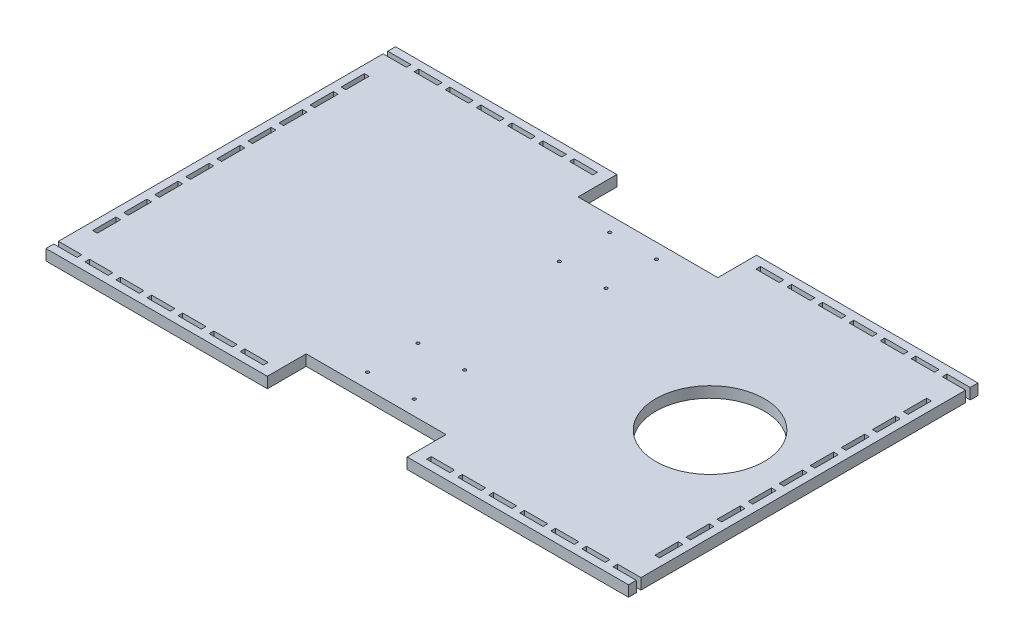
from build123d import *

# Parameters (mm, degrees)
SKETCH6_W           = 15
SKETCH6_H           = 3
SKETCH6_W_2         = 3
SKETCH6_H_2         = 15
SKETCH6_R           = 1
SKETCH6_R_2         = 35
BOSS_EXTRUDE3_DEPTH = 7


with BuildPart() as part:
    # Sketch6 → Boss-Extrude3 (new body)
    with BuildSketch(Plane(origin=(0, 0, 0), x_dir=(1, 0, 0), z_dir=(0, 1, 0))):
        Polygon((-45, 112.5), (-187.5, 112.5), (-187.5, 107.5), (-172.5, 107.5), (-172.5, 104.5), (-187.5, 104.5), (-187.5, -104.5), (-172.5, -104.5), (-172.5, -107.5), (-187.5, -107.5), (-187.5, -112.5), (-45, -112.5), (-45, -87.5), (45, -87.5), (45, -112.5), (187.5, -112.5), (187.5, -107.5), (172.5, -107.5), (172.5, -104.5), (187.5, -104.5), (187.5, 104.5), (172.5, 104.5), (172.5, 107.5), (187.5, 107.5), (187.5, 112.5), (45, 112.5), (45, 87.5), (-45, 87.5), align=None)
        with Locations((-160, -106)):
            Rectangle(SKETCH6_W, SKETCH6_H, mode=Mode.SUBTRACT)
        with Locations((-140, -106)):
            Rectangle(SKETCH6_W, SKETCH6_H, mode=Mode.SUBTRACT)
        with Locations((-120, -106)):
            Rectangle(SKETCH6_W, SKETCH6_H, mode=Mode.SUBTRACT)
        with Locations((-100, -106)):
            Rectangle(SKETCH6_W, SKETCH6_H, mode=Mode.SUBTRACT)
        with Locations((-181, -80)):
            Rectangle(SKETCH6_W_2, SKETCH6_H_2, mode=Mode.SUBTRACT)
        with Locations((-181, -60)):
            Rectangle(SKETCH6_W_2, SKETCH6_H_2, mode=Mode.SUBTRACT)
        with Locations((-80, -106)):
            Rectangle(SKETCH6_W, SKETCH6_H, mode=Mode.SUBTRACT)
        with Locations((-60, -106)):
            Rectangle(SKETCH6_W, SKETCH6_H, mode=Mode.SUBTRACT)
        with Locations((-15, -77.920021532)):
            Circle(SKETCH6_R, mode=Mode.SUBTRACT)
        with Locations((-181, -40)):
            Rectangle(SKETCH6_W_2, SKETCH6_H_2, mode=Mode.SUBTRACT)
        with Locations((-181, -20)):
            Rectangle(SKETCH6_W_2, SKETCH6_H_2, mode=Mode.SUBTRACT)
        with Locations((-15, -45.520021532)):
            Circle(SKETCH6_R, mode=Mode.SUBTRACT)
        with Locations((60, -106)):
            Rectangle(SKETCH6_W, SKETCH6_H, mode=Mode.SUBTRACT)
        with Locations((80, -106)):
            Rectangle(SKETCH6_W, SKETCH6_H, mode=Mode.SUBTRACT)
        with Locations((15, -77.920021532)):
            Circle(SKETCH6_R, mode=Mode.SUBTRACT)
        with Locations((100, -106)):
            Rectangle(SKETCH6_W, SKETCH6_H, mode=Mode.SUBTRACT)
        with Locations((120, -106)):
            Rectangle(SKETCH6_W, SKETCH6_H, mode=Mode.SUBTRACT)
        with Locations((140, -106)):
            Rectangle(SKETCH6_W, SKETCH6_H, mode=Mode.SUBTRACT)
        with Locations((160, -106)):
            Rectangle(SKETCH6_W, SKETCH6_H, mode=Mode.SUBTRACT)
        with Locations((181, -80)):
            Rectangle(SKETCH6_W_2, SKETCH6_H_2, mode=Mode.SUBTRACT)
        with Locations((181, -60)):
            Rectangle(SKETCH6_W_2, SKETCH6_H_2, mode=Mode.SUBTRACT)
        with Locations((15, -45.520021532)):
            Circle(SKETCH6_R, mode=Mode.SUBTRACT)
        with Locations((181, -40)):
            Rectangle(SKETCH6_W_2, SKETCH6_H_2, mode=Mode.SUBTRACT)
        with Locations((181, -20)):
            Rectangle(SKETCH6_W_2, SKETCH6_H_2, mode=Mode.SUBTRACT)
        with Locations((-181, 0)):
            Rectangle(SKETCH6_W_2, SKETCH6_H_2, mode=Mode.SUBTRACT)
        with Locations((-181, 20)):
            Rectangle(SKETCH6_W_2, SKETCH6_H_2, mode=Mode.SUBTRACT)
        with Locations((-181, 40)):
            Rectangle(SKETCH6_W_2, SKETCH6_H_2, mode=Mode.SUBTRACT)
        with Locations((-15, 45.520021532)):
            Circle(SKETCH6_R, mode=Mode.SUBTRACT)
        with Locations((-181, 60)):
            Rectangle(SKETCH6_W_2, SKETCH6_H_2, mode=Mode.SUBTRACT)
        with Locations((-181, 80)):
            Rectangle(SKETCH6_W_2, SKETCH6_H_2, mode=Mode.SUBTRACT)
        with Locations((-160, 106)):
            Rectangle(SKETCH6_W, SKETCH6_H, mode=Mode.SUBTRACT)
        with Locations((-140, 106)):
            Rectangle(SKETCH6_W, SKETCH6_H, mode=Mode.SUBTRACT)
        with Locations((-120, 106)):
            Rectangle(SKETCH6_W, SKETCH6_H, mode=Mode.SUBTRACT)
        with Locations((-100, 106)):
            Rectangle(SKETCH6_W, SKETCH6_H, mode=Mode.SUBTRACT)
        with Locations((-15, 77.920021532)):
            Circle(SKETCH6_R, mode=Mode.SUBTRACT)
        with Locations((-80, 106)):
            Rectangle(SKETCH6_W, SKETCH6_H, mode=Mode.SUBTRACT)
        with Locations((-60, 106)):
            Rectangle(SKETCH6_W, SKETCH6_H, mode=Mode.SUBTRACT)
        with Locations((15, 45.520021532)):
            Circle(SKETCH6_R, mode=Mode.SUBTRACT)
        with Locations((127.5, 0)):
            Circle(SKETCH6_R_2, mode=Mode.SUBTRACT)
        with Locations((181, 0)):
            Rectangle(SKETCH6_W_2, SKETCH6_H_2, mode=Mode.SUBTRACT)
        with Locations((181, 20)):
            Rectangle(SKETCH6_W_2, SKETCH6_H_2, mode=Mode.SUBTRACT)
        with Locations((181, 40)):
            Rectangle(SKETCH6_W_2, SKETCH6_H_2, mode=Mode.SUBTRACT)
        with Locations((15, 77.920021532)):
            Circle(SKETCH6_R, mode=Mode.SUBTRACT)
        with Locations((60, 106)):
            Rectangle(SKETCH6_W, SKETCH6_H, mode=Mode.SUBTRACT)
        with Locations((80, 106)):
            Rectangle(SKETCH6_W, SKETCH6_H, mode=Mode.SUBTRACT)
        with Locations((181, 60)):
            Rectangle(SKETCH6_W_2, SKETCH6_H_2, mode=Mode.SUBTRACT)
        with Locations((181, 80)):
            Rectangle(SKETCH6_W_2, SKETCH6_H_2, mode=Mode.SUBTRACT)
        with Locations((100, 106)):
            Rectangle(SKETCH6_W, SKETCH6_H, mode=Mode.SUBTRACT)
        with Locations((120, 106)):
            Rectangle(SKETCH6_W, SKETCH6_H, mode=Mode.SUBTRACT)
        with Locations((140, 106)):
            Rectangle(SKETCH6_W, SKETCH6_H, mode=Mode.SUBTRACT)
        with Locations((160, 106)):
            Rectangle(SKETCH6_W, SKETCH6_H, mode=Mode.SUBTRACT)
    extrude(amount=BOSS_EXTRUDE3_DEPTH)


solid = part.part
